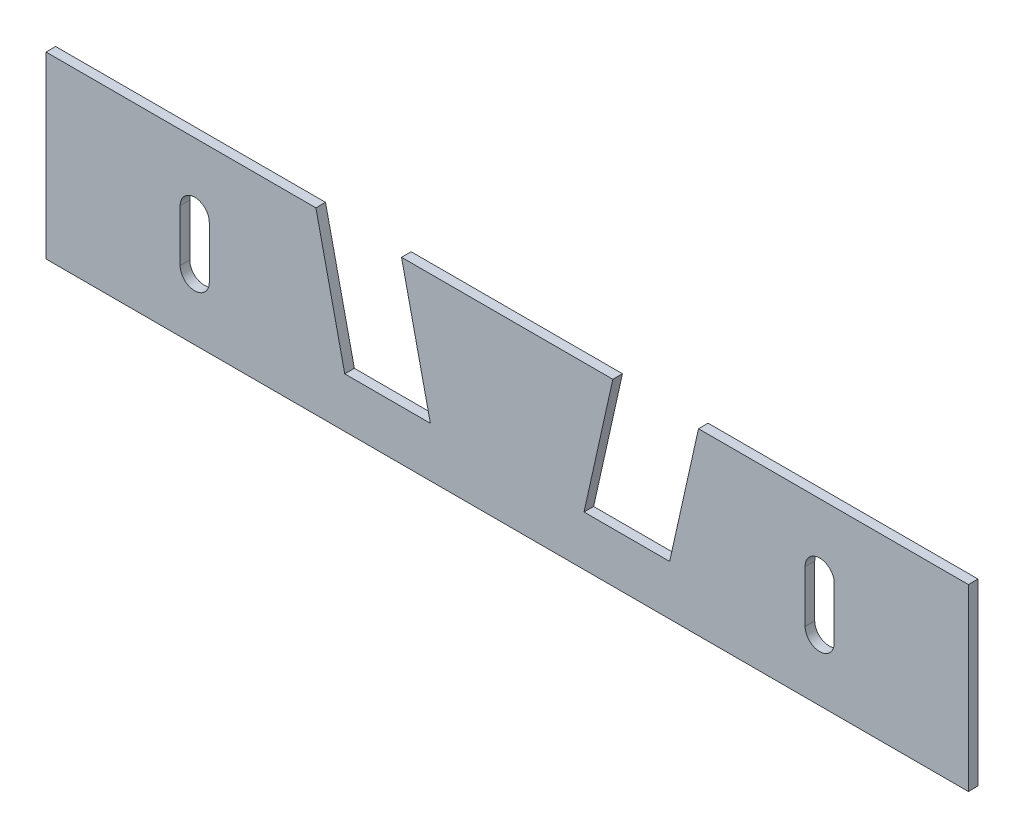
from build123d import *

# Parameters (mm, degrees)
SKETCH_1_R          = 1.5
EXTRUDE_1_DEPTH     = 1
CUT_EXTRUDE_1_DEPTH = 10


with BuildPart() as part:
    # Эскиз1 → Бобышка-Вытянуть1 (new body)
    with BuildSketch(Plane.XY):
        Polygon((-16.907759352, -48.261049679), (-19.909743959, -34.796210945), (-48, -34.796210945), (-48, -53.454190801), (48, -53.454190801), (48, -34.796210945), (19.909743959, -34.796210945), (16.907759352, -48.261049679), (7.995261788, -48.261049679), (10.997246395, -34.796210945), (-10.997246395, -34.796210945), (-7.995261788, -48.261049679), align=None)
        with Locations((-32.521447951, -44.364529328)):
            Circle(SKETCH_1_R, mode=Mode.SUBTRACT)
        with Locations((32.521447951, -44.364529328)):
            Circle(SKETCH_1_R, mode=Mode.SUBTRACT)
    extrude(amount=EXTRUDE_1_DEPTH)

    # Эскиз2 → Вырез-Вытянуть1 (cut)
    with BuildSketch(Plane.XY.offset(1)):
        with BuildLine():
            Line((-34.037126116, -47.066382625), (-34.037126116, -41.662676032))
            ThreePointArc((-34.037126116, -41.662676032), (-32.521447951, -40.146997867), (-31.005769787, -41.662676032))
            Line((-31.005769787, -41.662676032), (-31.005769787, -47.066382625))
            ThreePointArc((-31.005769787, -47.066382625), (-32.521447951, -48.58206079), (-34.037126116, -47.066382625))
        make_face()
        with BuildLine():
            Line((34.037126116, -47.066382625), (34.037126116, -41.662676032))
            ThreePointArc((34.037126116, -41.662676032), (32.521447951, -40.146997867), (31.005769787, -41.662676032))
            Line((31.005769787, -41.662676032), (31.005769787, -47.066382625))
            ThreePointArc((31.005769787, -47.066382625), (32.521447951, -48.58206079), (34.037126116, -47.066382625))
        make_face()
    extrude(amount=-CUT_EXTRUDE_1_DEPTH, mode=Mode.SUBTRACT)


solid = part.part
